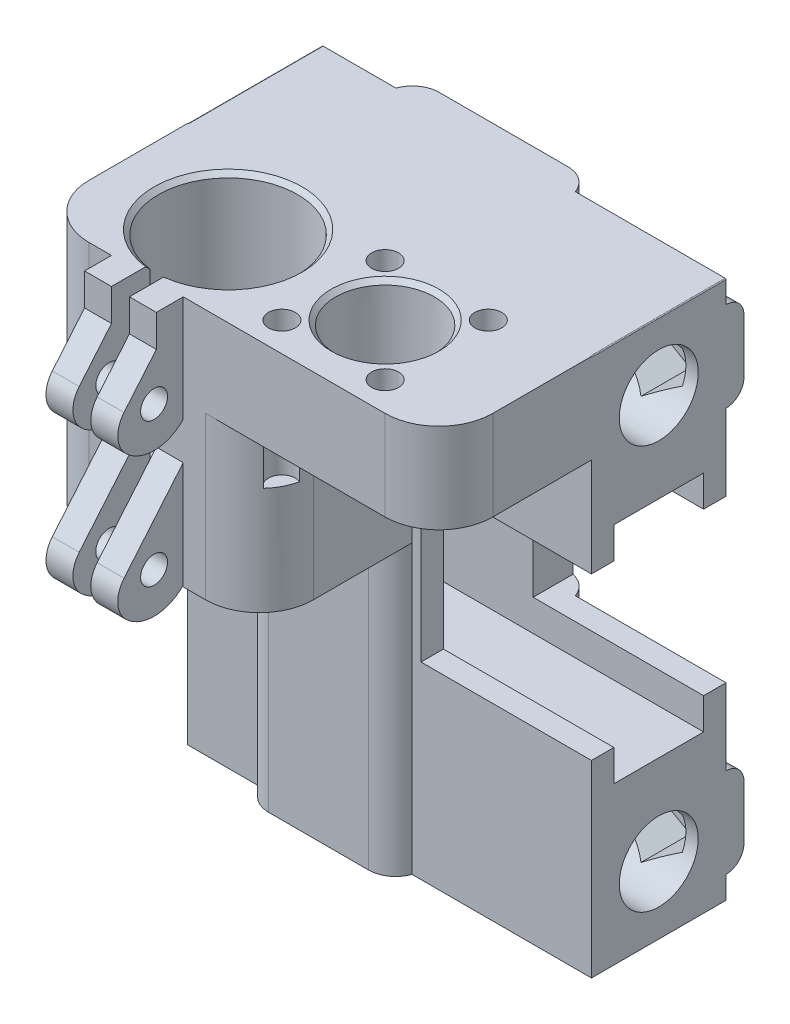
from build123d import *

# Parameters (mm, degrees)
SKETCH1_W                                = 45
SKETCH1_H                                = 60
MAINBODY_DEPTH                           = 15
SKETCH2_R                                = 4.4
SKETCH2_W                                = 10
SKETCH2_H                                = 25
RODCUTOUTS_DEPTH                         = 57.124860802
FILLET4_R                                = 0.1
SKETCH3_W                                = 17
SKETCH3_H                                = 10
BASE_DEPTH                               = 45
SKETCH4_W                                = 25
SKETCH4_H                                = 17
BOSS_EXTRUDE3_DEPTH                      = 18
SKETCH5_W                                = 2
SKETCH5_H                                = 30
CUT_EXTRUDE2_DEPTH                       = 5
SKETCH6_R                                = 5
F_8MMRODCUTOUT_DEPTH                     = 72.625763521
SKETCH7_R                                = 7.75
SKETCH7_R_2                              = 2.5
LM8UU_CARRIAGENUT_DEPTH                  = 24.5
SKETCH18_R                               = 1.5
CARRIAGENUTSCREWHOLES_DEPTH              = 16
FILLET1_R                                = 6
SKETCH11_R                               = 1.5
LM8UUSCREWLIP1_DEPTH                     = 3
LM8UUSCREWLIP2_START                     = 5
SKETCH11_2_R                             = 1.5
LM8UUSCREWLIP2_DEPTH                     = 3
LM8UUSCREWFILLET_R                       = 3
MIRROR1_START                            = -2.25
MIRROR1_OUTLINE_W                        = 10
MIRROR1_OUTLINE_H                        = 17
MIRROR1_DEPTH                            = 2.4999999
MIRROR1_START_2                          = -14
MIRROR1_2_OUTLINE_R                      = 1.5
MIRROR1_2_DEPTH                          = 3
MIRROR1_START_3                          = -9
MIRROR1_3_OUTLINE_R                      = 1.5
MIRROR1_3_DEPTH                          = 3
MIRROR1_START_4                          = 14.7500001
MIRROR1_4_OUTLINE_W                      = 10
MIRROR1_4_OUTLINE_H                      = 17
MIRROR1_4_DEPTH                          = 1.7499999
MIRROR1_START_5                          = 3.2500001
MIRROR1_5_OUTLINE_W                      = 10
MIRROR1_5_OUTLINE_H                      = 17
MIRROR1_5_DEPTH                          = 1.7499998
MIRROR1_START_6                          = 10.0000001
MIRROR1_6_OUTLINE_W                      = 10
MIRROR1_6_OUTLINE_H                      = 17
MIRROR1_6_DEPTH                          = 1.7499998
MIRROR1_START_7                          = 2
MIRROR1_7_DEPTH                          = 28
MIRROR1_START_8                          = 20
MIRROR1_8_DEPTH                          = 10
MIRROR1_9_DEPTH                          = 3.5
MIRROR1_START_9                          = 5.5
MIRROR1_10_DEPTH                         = 8.5
IDLERSCREWHOLE_DEPTH                     = 3
IDLERSCREWHOLE_DEPTH_BACK                = 45.683616854
SKETCH15_R                               = 2.125
IDLERNUTTRAP_DEPTH                       = 4
SKETCH19_W                               = 38
SKETCH19_H                               = 18
IDLERSQUARECUTOUT_DEPTH                  = 45.683616854
SKETCH22_W                               = 30
SKETCH22_H                               = 30
CUT_EXTRUDE3_DEPTH                       = 67.85286085
SKETCH20_W                               = 16.8
SKETCH20_H                               = 2
BOSS_EXTRUDE9_DEPTH                      = 32
SKETCH21_W                               = 20
SKETCH21_H                               = 2
BOSS_EXTRUDE10_DEPTH                     = 60
FILLET5_R                                = 3
SKETCH30_R                               = 5.5
CUT_EXTRUDE8_DEPTH                       = 12
SKETCH24_R                               = 8.25
ANTI_SMOOSH_DEPTH                        = 2
ANTI_SMOOSH_DRAFT                        = -45
SKETCH24_R_2                             = 6
ANTI_SMOOSH_PROFILE_2_DEPTH              = 2
ANTI_SMOOSH_PROFILE_2_DRAFT              = -45
BOSS_EXTRUDE13_START                     = -45.000025
BOSS_EXTRUDE13_DEPTH                     = 45.000025
RODTIGHTENERSCREWHOLES_REACH             = 56.319
SKETCH23_R                               = 1.75
RODTIGHTENERSCREWHOLES_DIRECTION_2_DEPTH = 55.319021891
RODTIGHTENERNUTTRAPS_REACH               = 56.319
RODTIGHTENERNUTTRAPS_DIRECTION_2_DEPTH   = 0.5
BOSS_EXTRUDE14_REACH                     = 77.17
SKETCH31_W                               = 3
SKETCH31_H                               = 3
BOSS_EXTRUDE15_START                     = -0.5
SKETCH32_R                               = 6
SKETCH32_R_2                             = 5.5
BOSS_EXTRUDE15_DEPTH                     = 9.5
BOSS_EXTRUDE15_DRAFT                     = 2
SKETCH33_W                               = 2.2
SKETCH33_H                               = 18
CUT_EXTRUDE9_DEPTH                       = 55.319021891


with BuildPart() as part:
    # Sketch1 → MainBody (new body)
    with BuildSketch(Plane.XY):
        Rectangle(SKETCH1_W, SKETCH1_H)
    extrude(amount=MAINBODY_DEPTH)

    # Sketch2 → RodCutouts (cut, through all)
    with BuildSketch(Plane(origin=(22.5, 0, 0), x_dir=(0, 0, -1), z_dir=(1, 0, 0))):
        with Locations((-7.5, 22.5)):
            Circle(SKETCH2_R)
        with Locations((-7.5, -22.5)):
            Circle(SKETCH2_R)
        with Locations((-7.5, 0)):
            Rectangle(SKETCH2_W, SKETCH2_H)
    extrude(amount=-RODCUTOUTS_DEPTH, mode=Mode.SUBTRACT)

    # Fillet4
    fillet4_edges = [part.edges().sort_by_distance(p)[0] for p in [
        (-22.5, 30, 7.5),
        (22.5, 30, 7.5),
    ]]
    fillet(fillet4_edges, radius=FILLET4_R)

    # Sketch3 → Base (add)
    with BuildSketch(Plane.ZY.offset(22.5)):
        with Locations((23.5, -25)):
            Rectangle(SKETCH3_W, SKETCH3_H)
    extrude(amount=-BASE_DEPTH)

    # Sketch4 → Boss-Extrude3 (add)
    with BuildSketch(Plane(origin=(0, -20, 0), x_dir=(1, 0, 0), z_dir=(0, 1, 0))):
        with Locations((-10, -23.5)):
            Rectangle(SKETCH4_W, SKETCH4_H)
    extrude(amount=BOSS_EXTRUDE3_DEPTH)

    # Sketch5 → Cut-Extrude2 (cut)
    with BuildSketch(Plane.XY.offset(32)):
        with Locations((-10, -16)):
            Rectangle(SKETCH5_W, SKETCH5_H)
    extrude(amount=-CUT_EXTRUDE2_DEPTH, mode=Mode.SUBTRACT)

    # Sketch6 → 8mmRodCutout (cut, through all)
    with BuildSketch(Plane.XZ.offset(30)):
        with Locations((-10, 23)):
            Circle(SKETCH6_R)
    extrude(amount=-F_8MMRODCUTOUT_DEPTH, mode=Mode.SUBTRACT)

    # Sketch7 → LM8UU&CarriageNut (cut)
    with BuildSketch(Plane.XZ.offset(30)):
        with Locations((-10, 23)):
            Circle(SKETCH7_R)
        with Locations(Location((7.5, 23, 0), (0, 0, 270))):
            Circle(SKETCH7_R_2)
    extrude(amount=-LM8UU_CARRIAGENUT_DEPTH, mode=Mode.SUBTRACT)

    # Sketch18 → CarriageNutScrewholes (cut)
    with BuildSketch(Plane.XZ.offset(30)):
        with Locations(Location((1.75, 28.75, 0), (0, 0, 270))):
            Circle(SKETCH18_R)
        with Locations(Location((13.25, 28.75, 0), (0, 0, 90))):
            Circle(SKETCH18_R)
        with Locations(Location((13.25, 17.25, 0), (0, 0, 270))):
            Circle(SKETCH18_R)
        with Locations(Location((1.75, 17.25, 0), (0, 0, 300))):
            Circle(SKETCH18_R)
    extrude(amount=-CARRIAGENUTSCREWHOLES_DEPTH, mode=Mode.SUBTRACT)

    # Fillet1
    # the kernel refuses this fillet: 6 mm, written as the material it takes off along each edge
    with BuildSketch(Plane(origin=(-22.5, -45, 32), x_dir=(0, 0, -1), z_dir=(0, 1, 0))) as fillet1_piece_1:
        with BuildLine():
            CenterArc((FILLET1_R, -FILLET1_R), FILLET1_R, 90, 90)
            Line((0, -FILLET1_R), (0, 0))
            Line((0, 0), (FILLET1_R, 0))
        make_face()
    extrude(amount=58, mode=Mode.SUBTRACT)
    with BuildSketch(Plane(origin=(22.5, -45, 32), x_dir=(0, 0, -1), z_dir=(0, 1, 0))) as fillet1_piece_2:
        with BuildLine():
            CenterArc((FILLET1_R, FILLET1_R), FILLET1_R, 180, 90)
            Line((0, FILLET1_R), (0, 0))
            Line((0, 0), (FILLET1_R, 0))
        make_face()
    extrude(amount=40, mode=Mode.SUBTRACT)
    with BuildSketch(Plane(origin=(2.5, -20, 32), x_dir=(0, 0, -1), z_dir=(0, 1, 0))) as fillet1_piece_3:
        with BuildLine():
            CenterArc((FILLET1_R, FILLET1_R), FILLET1_R, 180, 90)
            Line((0, FILLET1_R), (0, 0))
            Line((0, 0), (FILLET1_R, 0))
        make_face()
    extrude(amount=33, mode=Mode.SUBTRACT)

    # Sketch11 → LM8UUScrewLip1 (add)
    # profile 1 of 2: a face of its own
    with BuildSketch(Plane(origin=(-11, 0, 0), x_dir=(0, 0, -1), z_dir=(1, 0, 0))):
        with BuildLine():
            Line((-32, -30), (-39.723357705, -20.795660708))
            ThreePointArc((-39.723357705, -20.795660708), (-35.655854673, -16.802948792), (-30.937253933, -20))
            Line((-30.937253933, -20), (-30.937253933, -30))
            Line((-30.937253933, -30), (-32, -30))
        make_face()
        with Locations(Location((-35.25, -21.284609421, 0), (0, 0, 90))):
            Circle(SKETCH11_R, mode=Mode.SUBTRACT)
    # profile 2 of 2: a face of its own
    with BuildSketch(Plane(origin=(-11, 0, 0), x_dir=(0, 0, -1), z_dir=(1, 0, 0))):
        with BuildLine():
            Line((-30.937253933, -4), (-30.937253933, -14))
            Line((-30.937253933, -14), (-32, -14))
            Line((-32, -14), (-39.723357705, -4.795660708))
            ThreePointArc((-39.723357705, -4.795660708), (-35.655854673, -0.802948792), (-30.937253933, -4))
        make_face()
        with Locations(Location((-35.25, -5.284609421, 0), (0, 0, 90))):
            Circle(SKETCH11_R, mode=Mode.SUBTRACT)
    extrude(amount=-LM8UUSCREWLIP1_DEPTH)

    # Sketch11<2> → LM8UUScrewLip2 (add)
    # profile 1 of 2: a face of its own
    with BuildSketch(Plane(origin=(-11, 0, 0), x_dir=(0, 0, -1), z_dir=(1, 0, 0)).offset(LM8UUSCREWLIP2_START)):
        with BuildLine():
            Line((-32, -30), (-39.723357705, -20.795660708))
            ThreePointArc((-39.723357705, -20.795660708), (-35.655854673, -16.802948792), (-30.937253933, -20))
            Line((-30.937253933, -20), (-30.937253933, -30))
            Line((-30.937253933, -30), (-32, -30))
        make_face()
        with Locations(Location((-35.25, -21.284609421, 0), (0, 0, 90))):
            Circle(SKETCH11_2_R, mode=Mode.SUBTRACT)
    # profile 2 of 2: a face of its own
    with BuildSketch(Plane(origin=(-11, 0, 0), x_dir=(0, 0, -1), z_dir=(1, 0, 0)).offset(LM8UUSCREWLIP2_START)):
        with BuildLine():
            Line((-30.937253933, -4), (-30.937253933, -14))
            Line((-30.937253933, -14), (-32, -14))
            Line((-32, -14), (-39.723357705, -4.795660708))
            ThreePointArc((-39.723357705, -4.795660708), (-35.655854673, -0.802948792), (-30.937253933, -4))
        make_face()
        with Locations(Location((-35.25, -5.284609421, 0), (0, 0, 90))):
            Circle(SKETCH11_2_R, mode=Mode.SUBTRACT)
    extrude(amount=-LM8UUSCREWLIP2_DEPTH)

    # LM8UUScrewFillet
    lm8uuscrewfillet_edges = [part.edges().sort_by_distance(p)[0] for p in [
        (-12.5, -20.795660708, 39.723357705),
        (-12.5, -4.795660708, 39.723357705),
        (-7.5, -20.795660708, 39.723357705),
        (-7.5, -4.795660708, 39.723357705),
    ]]
    fillet(lm8uuscrewfillet_edges, radius=LM8UUSCREWFILLET_R)

    # Mirror1: read off the stored shape, not the designer's step
    # Mirror1 outline → Mirror1 (add)
    with BuildSketch(Plane.YZ.offset(MIRROR1_START)):
        with Locations((25, 23.5)):
            Rectangle(MIRROR1_OUTLINE_W, MIRROR1_OUTLINE_H)
    extrude(amount=MIRROR1_DEPTH)

    # Mirror1 4 outline → Mirror1 4 (add)
    with BuildSketch(Plane.YZ.offset(MIRROR1_START_4)):
        with Locations((25, 23.5)):
            Rectangle(MIRROR1_4_OUTLINE_W, MIRROR1_4_OUTLINE_H)
    extrude(amount=MIRROR1_4_DEPTH)

    # Mirror1 5 outline → Mirror1 5 (add)
    with BuildSketch(Plane.YZ.offset(MIRROR1_START_5)):
        with Locations((25, 23.5)):
            Rectangle(MIRROR1_5_OUTLINE_W, MIRROR1_5_OUTLINE_H)
    extrude(amount=MIRROR1_5_DEPTH)

    # Mirror1 6 outline → Mirror1 6 (add)
    with BuildSketch(Plane.YZ.offset(MIRROR1_START_6)):
        with Locations((25, 23.5)):
            Rectangle(MIRROR1_6_OUTLINE_W, MIRROR1_6_OUTLINE_H)
    extrude(amount=MIRROR1_6_DEPTH)



with BuildPart() as body_2:
    # Mirror1 2 outline → Mirror1 2 (new body)
    # profile 1 of 2: a face of its own
    with BuildSketch(Plane.YZ.offset(MIRROR1_START_2)):
        with BuildLine():
            ThreePointArc((2.064060508, 38.392938863), (0.785252302, 35.173937395), (2.172134521, 32))
            Line((2.172134521, 32), (14, 32))
            Line((14, 32), (6.139455945, 38.595779617))
            ThreePointArc((6.139455945, 38.595779617), (4.061961594, 39.293937293), (2.064060508, 38.392938863))
        make_face()
        with Locations((5.284609421, 35.25)):
            Circle(MIRROR1_2_OUTLINE_R, mode=Mode.SUBTRACT)
    # profile 2 of 2: a face of its own
    with BuildSketch(Plane.YZ.offset(MIRROR1_START_2)):
        with BuildLine():
            ThreePointArc((18.064060508, 38.392938863), (16.785252302, 35.173937395), (18.172134521, 32))
            Line((18.172134521, 32), (30, 32))
            Line((30, 32), (22.139455945, 38.595779617))
            ThreePointArc((22.139455945, 38.595779617), (20.061961594, 39.293937293), (18.064060508, 38.392938863))
        make_face()
        with Locations((21.284609421, 35.25)):
            Circle(MIRROR1_2_OUTLINE_R, mode=Mode.SUBTRACT)
    extrude(amount=MIRROR1_2_DEPTH)


with BuildPart() as body_3:
    # Mirror1 3 outline → Mirror1 3 (new body)
    # profile 1 of 2: a face of its own
    with BuildSketch(Plane.YZ.offset(MIRROR1_START_3)):
        with BuildLine():
            ThreePointArc((2.064060508, 38.392938863), (0.785252302, 35.173937395), (2.172134521, 32))
            Line((2.172134521, 32), (14, 32))
            Line((14, 32), (6.139455945, 38.595779617))
            ThreePointArc((6.139455945, 38.595779617), (4.061961594, 39.293937293), (2.064060508, 38.392938863))
        make_face()
        with Locations((5.284609421, 35.25)):
            Circle(MIRROR1_3_OUTLINE_R, mode=Mode.SUBTRACT)
    # profile 2 of 2: a face of its own
    with BuildSketch(Plane.YZ.offset(MIRROR1_START_3)):
        with BuildLine():
            ThreePointArc((18.064060508, 38.392938863), (16.785252302, 35.173937395), (18.172134521, 32))
            Line((18.172134521, 32), (30, 32))
            Line((30, 32), (22.139455945, 38.595779617))
            ThreePointArc((22.139455945, 38.595779617), (20.061961594, 39.293937293), (18.064060508, 38.392938863))
        make_face()
        with Locations((21.284609421, 35.25)):
            Circle(MIRROR1_3_OUTLINE_R, mode=Mode.SUBTRACT)
    extrude(amount=MIRROR1_3_DEPTH)


with BuildPart() as part_1:
    add(part.part)

    add(body_2.part)  # Mirror1 7 merges body 2

    add(body_3.part)  # Mirror1 7 merges body 3
    # Mirror1 7 outline → Mirror1 7 (add)
    with BuildSketch(Plane(origin=(0, 0, 0), x_dir=(1, 0, 0), z_dir=(0, 1, 0)).offset(MIRROR1_START_7)):
        with BuildLine():
            Line((-11, -32), (-11, -30.685213074))
            ThreePointArc((-11, -30.685213074), (-10, -15.25), (-9, -30.685213074))
            Line((-9, -30.685213074), (-9, -32))
            Line((-9, -32), (-3.5, -32))
            ThreePointArc((-3.5, -32), (-1.063368525, -31.482957875), (0.953315911, -30.020942352))
            ThreePointArc((0.953315911, -30.020942352), (0.421252697, -28.053989508), (2.341168075, -27.371406402))
            ThreePointArc((2.341168075, -27.371406402), (2.460159748, -26.690286734), (2.5, -26))
            Line((2.5, -26), (2.5, -18.549038106))
            ThreePointArc((2.5, -18.549038106), (0.25, -17.25), (2.5, -15.950961894))
            Line((2.5, -15.950961894), (2.5, -15))
            Line((2.5, -15), (-22.5, -15))
            Line((-22.5, -15), (-22.5, -26))
            ThreePointArc((-22.5, -26), (-20.742640687, -30.242640687), (-16.5, -32))
            Line((-16.5, -32), (-11, -32))
        make_face()
    extrude(amount=MIRROR1_7_DEPTH)

    # Mirror1 8 outline → Mirror1 8 (add)
    with BuildSketch(Plane(origin=(0, 0, 0), x_dir=(1, 0, 0), z_dir=(0, 1, 0)).offset(MIRROR1_START_8)):
        with BuildLine():
            Line((-2.25, -32), (-2.25, -31.868347297))
            ThreePointArc((-2.25, -31.868347297), (-2.871543073, -31.966996053), (-3.5, -32))
            Line((-3.5, -32), (-2.25, -32))
        make_face()
        with BuildLine():
            ThreePointArc((0.953315911, -30.020942352), (0.615024374, -30.366528873), (0.2499999, -30.683748579))
            Line((0.2499999, -30.683748579), (0.2499999, -32))
            Line((0.2499999, -32), (3.2500001, -32))
            Line((3.2500001, -32), (3.25, -28.75))
            ThreePointArc((3.25, -28.75), (2.476282957, -30.062445453), (0.953315911, -30.020942352))
        make_face()
        with BuildLine():
            Line((3.2500001, -15), (2.5, -15))
            Line((2.5, -15), (2.5, -15.950961894))
            ThreePointArc((2.5, -15.950961894), (3.049038106, -16.5), (3.25, -17.25))
            Line((3.25, -17.25), (3.2500001, -15))
        make_face()
        with BuildLine():
            ThreePointArc((2.341168075, -27.371406402), (3.002348217, -27.924394801), (3.25, -28.75))
            Line((3.25, -28.75), (3.25, -17.25))
            ThreePointArc((3.25, -17.25), (3.049038106, -18), (2.5, -18.549038106))
            Line((2.5, -18.549038106), (2.5, -26))
            ThreePointArc((2.5, -26), (2.460159748, -26.690286734), (2.341168075, -27.371406402))
        make_face()
        with BuildLine():
            Line((5, -23), (4.9999999, -32))
            Line((4.9999999, -32), (10.0000001, -32))
            Line((10.0000001, -32), (10, -23))
            ThreePointArc((10, -23), (7.5, -25.5), (5, -23))
        make_face()
        with BuildLine():
            Line((10.0000001, -15), (4.9999999, -15))
            Line((4.9999999, -15), (5, -23))
            ThreePointArc((5, -23), (7.5, -20.5), (10, -23))
            Line((10, -23), (10.0000001, -15))
        make_face()
        with BuildLine():
            Line((11.75, -28.75), (11.7499999, -32))
            Line((11.7499999, -32), (14.7500001, -32))
            Line((14.7500001, -32), (14.75, -28.75))
            ThreePointArc((14.75, -28.75), (13.25, -30.25), (11.75, -28.75))
        make_face()
        with BuildLine():
            Line((14.7500001, -15), (11.7499999, -15))
            Line((11.7499999, -15), (11.75, -17.25))
            ThreePointArc((11.75, -17.25), (13.25, -15.75), (14.75, -17.25))
            Line((14.75, -17.25), (14.7500001, -15))
        make_face()
        with BuildLine():
            Line((11.75, -17.25), (11.75, -28.75))
            ThreePointArc((11.75, -28.75), (13.25, -27.25), (14.75, -28.75))
            Line((14.75, -28.75), (14.75, -17.25))
            ThreePointArc((14.75, -17.25), (13.25, -18.75), (11.75, -17.25))
        make_face()
        with BuildLine():
            Line((16.5, -15), (16.5, -32))
            ThreePointArc((16.5, -32), (20.742640687, -30.242640687), (22.5, -26))
            Line((22.5, -26), (22.5, -15))
            Line((22.5, -15), (16.5, -15))
        make_face()
    extrude(amount=MIRROR1_8_DEPTH)

    # Mirror1 9 outline → Mirror1 9 (add)
    with BuildSketch(Plane(origin=(0, 0, 0), x_dir=(1, 0, 0), z_dir=(0, 1, 0)).offset(MIRROR1_START_7)):
        with BuildLine():
            ThreePointArc((-9, -30.685213074), (-10, -15.25), (-11, -30.685213074))
            Line((-11, -30.685213074), (-11, -27.898979486))
            ThreePointArc((-11, -27.898979486), (-10, -18), (-9, -27.898979486))
            Line((-9, -27.898979486), (-9, -30.685213074))
        make_face()
        with BuildLine():
            ThreePointArc((2.341168075, -27.371406402), (0.421252697, -28.053989508), (0.953315911, -30.020942352))
            ThreePointArc((0.953315911, -30.020942352), (1.814989212, -28.784041968), (2.341168075, -27.371406402))
        make_face()
        with BuildLine():
            ThreePointArc((2.5, -15.950961894), (0.25, -17.25), (2.5, -18.549038106))
            Line((2.5, -18.549038106), (2.5, -15.950961894))
        make_face()
    extrude(amount=MIRROR1_9_DEPTH)

    # Mirror1 10 outline → Mirror1 10 (add)
    with BuildSketch(Plane(origin=(0, 0, 0), x_dir=(1, 0, 0), z_dir=(0, 1, 0)).offset(MIRROR1_START_9)):
        with BuildLine():
            ThreePointArc((2.341168075, -27.371406402), (0.421252697, -28.053989508), (0.953315911, -30.020942352))
            ThreePointArc((0.953315911, -30.020942352), (1.814989212, -28.784041968), (2.341168075, -27.371406402))
        make_face()
        with BuildLine():
            ThreePointArc((2.5, -15.950961894), (0.25, -17.25), (2.5, -18.549038106))
            Line((2.5, -18.549038106), (2.5, -15.950961894))
        make_face()
    extrude(amount=MIRROR1_10_DEPTH)

    # Sketch15 → IdlerScrewHole (cut, two sides: drawn at the far end of the back side and taken through both)
    with BuildSketch(Plane.XY.offset(15).offset(-IDLERSCREWHOLE_DEPTH_BACK)):
        with Locations(Location((-18, 0, 0), (0, 0, 109.749922796))):
            Circle(SKETCH15_R)
    extrude(amount=IDLERSCREWHOLE_DEPTH + IDLERSCREWHOLE_DEPTH_BACK, mode=Mode.SUBTRACT)

    # Sketch17 → IdlerNutTrap (cut)
    with BuildSketch(Plane.XY.offset(15)):
        Polygon((-14.3, 2.136195996), (-18, 4.272391992), (-21.7, 2.136195996), (-21.7, -2.136195996), (-18, -4.272391992), (-14.3, -2.136195996), align=None)
    extrude(amount=IDLERNUTTRAP_DEPTH, mode=Mode.SUBTRACT)

    # Sketch19 → IdlerSquareCutout (cut, through all)
    with BuildSketch(Plane.XY.offset(15)):
        with Locations((22.5, 0)):
            Rectangle(SKETCH19_W, SKETCH19_H)
    extrude(amount=-IDLERSQUARECUTOUT_DEPTH, mode=Mode.SUBTRACT)

    # Sketch22 → Cut-Extrude3 (cut, through all)
    with BuildSketch(Plane(origin=(22.5, 0, 0), x_dir=(0, 0, -1), z_dir=(1, 0, 0))):
        with Locations((-30, -15)):
            Rectangle(SKETCH22_W, SKETCH22_H)
    extrude(amount=-CUT_EXTRUDE3_DEPTH, mode=Mode.SUBTRACT)

    # Sketch20 → Boss-Extrude9 (add, through all)
    with BuildSketch(Plane(origin=(0, 2, 0), x_dir=(1, 0, 0), z_dir=(0, 1, 0))):
        with Locations((-5.9, -16)):
            Rectangle(SKETCH20_W, SKETCH20_H)
    extrude(amount=-BOSS_EXTRUDE9_DEPTH)

    # Sketch21 → Boss-Extrude10 (add, through all)
    with BuildSketch(Plane.XZ.offset(30)):
        with Locations((-4.3, -1)):
            Rectangle(SKETCH21_W, SKETCH21_H)
    extrude(amount=-BOSS_EXTRUDE10_DEPTH)

    # Fillet5
    # the kernel refuses this fillet: 3 mm, written as the material it takes off along each edge
    with BuildSketch(Plane(origin=(-14.3, 2, 17), x_dir=(0, 0, -1), z_dir=(0, -1, 0))) as fillet5_piece_1:
        with BuildLine():
            CenterArc((3, 2.828427125), FILLET5_R, 180, 70.528779366)
            Line((0, 2.828427125), (-0.06, 2.828427125))
            Line((-0.06, 2.828427125), (-0.06, 0))
            Line((-0.06, 0), (0, -0.06))
            ThreePointArc((0, -0.06), (1, -0.06), (1.98, -0.056568542))
            Line((1.98, -0.056568542), (2, 0))
        make_face()
    extrude(amount=39.071067812, mode=Mode.SUBTRACT)
    with BuildSketch(Plane(origin=(2.5, 2, 17), x_dir=(0, 0, -1), z_dir=(0, -1, 0))) as fillet5_piece_2:
        with BuildLine():
            CenterArc((3, -2.828427125), FILLET5_R, 109.471220634, 70.528779366)
            Line((0, -2.828427125), (-0.06, -2.828427125))
            Line((-0.06, -2.828427125), (-0.06, 0))
            Line((-0.06, 0), (0, 0.06))
            ThreePointArc((0, 0.06), (1, 0.06), (1.98, 0.056568542))
            Line((1.98, 0.056568542), (2, 0))
        make_face()
    extrude(amount=39.071067812, mode=Mode.SUBTRACT)
    with BuildSketch(Plane(origin=(-14.3, -37.071067812, -2), x_dir=(0, 0, 1), z_dir=(0, 1, 0))) as fillet5_piece_3:
        with BuildLine():
            CenterArc((3, 2.828427125), FILLET5_R, 180, 70.528779366)
            Line((0, 2.828427125), (-0.06, 2.828427125))
            Line((-0.06, 2.828427125), (-0.06, 0))
            Line((-0.06, 0), (0, -0.06))
            ThreePointArc((0, -0.06), (1, -0.06), (1.98, -0.056568542))
            Line((1.98, -0.056568542), (2, 0))
        make_face()
    extrude(amount=74.142135624, mode=Mode.SUBTRACT)
    with BuildSketch(Plane(origin=(5.7, -37.071067812, -2), x_dir=(0, 0, 1), z_dir=(0, 1, 0))) as fillet5_piece_4:
        with BuildLine():
            CenterArc((3, -2.828427125), FILLET5_R, 109.471220634, 70.528779366)
            Line((0, -2.828427125), (-0.06, -2.828427125))
            Line((-0.06, -2.828427125), (-0.06, 0))
            Line((-0.06, 0), (0, 0.06))
            ThreePointArc((0, 0.06), (1, 0.06), (1.98, 0.056568542))
            Line((1.98, 0.056568542), (2, 0))
        make_face()
    extrude(amount=74.142135624, mode=Mode.SUBTRACT)

    # Sketch30 → Cut-Extrude8 (cut)
    with BuildSketch(Plane(origin=(0, 30, 0), x_dir=(1, 0, 0), z_dir=(0, 1, 0))):
        with Locations(Location((7.5, -23, 0), (0, 0, 270))):
            Circle(SKETCH30_R)
    extrude(amount=-CUT_EXTRUDE8_DEPTH, mode=Mode.SUBTRACT)


with BuildPart() as anti_smoosh_tool:
    # Sketch24 → anti-smoosh (with draft: the straight prism first)
    with BuildSketch(Plane(origin=(0, 30, 0), x_dir=(1, 0, 0), z_dir=(0, 1, 0))):
        with Locations((-10, -23)):
            Circle(SKETCH24_R)
    extrude(amount=-ANTI_SMOOSH_DEPTH)
    # anti-smoosh: the draft: its side faces are tilted about the plane it starts from
    anti_smoosh_sides = [anti_smoosh_tool.faces().sort_by_distance(p)[0] for p in [
        (-18.25, 29, 23),
    ]]
    draft(anti_smoosh_sides, Plane(origin=(0, 30, 0), x_dir=(1, 0, 0), z_dir=(0, 1, 0)), ANTI_SMOOSH_DRAFT)


with BuildPart() as part_2:
    add(part_1.part)

    # anti-smoosh: cut by anti_smoosh_tool
    add(anti_smoosh_tool.part, mode=Mode.SUBTRACT)


with BuildPart() as anti_smoosh_profile_2_tool:
    # Sketch24 → anti-smoosh profile 2 (with draft: the straight prism first)
    with BuildSketch(Plane(origin=(0, 30, 0), x_dir=(1, 0, 0), z_dir=(0, 1, 0))):
        with Locations((7.5, -23)):
            Circle(SKETCH24_R_2)
    extrude(amount=-ANTI_SMOOSH_PROFILE_2_DEPTH)
    # anti-smoosh profile 2: the draft: its side faces are tilted about the plane it starts from
    anti_smoosh_profile_2_sides = [anti_smoosh_profile_2_tool.faces().sort_by_distance(p)[0] for p in [
        (1.5, 29, 23),
    ]]
    draft(anti_smoosh_profile_2_sides, Plane(origin=(0, 30, 0), x_dir=(1, 0, 0), z_dir=(0, 1, 0)), ANTI_SMOOSH_PROFILE_2_DRAFT)


with BuildPart() as part_3:
    add(part_2.part)

    # anti-smoosh profile 2: cut by anti_smoosh_profile_2_tool
    add(anti_smoosh_profile_2_tool.part, mode=Mode.SUBTRACT)

    # Sketch29 → Boss-Extrude13 (add)
    with BuildSketch(Plane(origin=(22.5, 0, 0), x_dir=(0, 0, -1), z_dir=(1, 0, 0)).offset(BOSS_EXTRUDE13_START)):
        with BuildLine():
            Line((2, 19.5), (2, 25.5))
            ThreePointArc((2, 25.5), (1.414213562, 26.914213562), (0, 27.5))
            Line((0, 27.5), (0, 17.5))
            ThreePointArc((0, 17.5), (1.414213562, 18.085786438), (2, 19.5))
        make_face()
        with BuildLine():
            Line((0, -27.5), (0, -17.5))
            ThreePointArc((0, -17.5), (1.414213562, -18.085786438), (2, -19.5))
            Line((2, -19.5), (2, -25.5))
            ThreePointArc((2, -25.5), (1.414213562, -26.914213562), (0, -27.5))
        make_face()
    extrude(amount=BOSS_EXTRUDE13_DEPTH)

    # Sketch23 → RodTightenerScrewHoles (cut, up to next)
    with BuildSketch(Plane(origin=(0, 0, 0), x_dir=(-1, 0, 0), z_dir=(0, 0, -1)), mode=Mode.PRIVATE) as rodtightenerscrewholes_sk1:
        with Locations((-18, 22.5)):
            Circle(SKETCH23_R)
    rodtightenerscrewholes_tool1 = extrude(rodtightenerscrewholes_sk1.sketch, amount=-RODTIGHTENERSCREWHOLES_REACH, mode=Mode.PRIVATE) & part_3.part
    # Sketch23 → RodTightenerScrewHoles (cut, up to next)
    with BuildSketch(Plane(origin=(0, 0, 0), x_dir=(-1, 0, 0), z_dir=(0, 0, -1)), mode=Mode.PRIVATE) as rodtightenerscrewholes_sk2:
        with Locations((18, 22.5)):
            Circle(SKETCH23_R)
    rodtightenerscrewholes_tool2 = extrude(rodtightenerscrewholes_sk2.sketch, amount=-RODTIGHTENERSCREWHOLES_REACH, mode=Mode.PRIVATE) & part_3.part
    # Sketch23 → RodTightenerScrewHoles (cut, up to next)
    with BuildSketch(Plane(origin=(0, 0, 0), x_dir=(-1, 0, 0), z_dir=(0, 0, -1)), mode=Mode.PRIVATE) as rodtightenerscrewholes_sk3:
        with Locations((18, -22.5)):
            Circle(SKETCH23_R)
    rodtightenerscrewholes_tool3 = extrude(rodtightenerscrewholes_sk3.sketch, amount=-RODTIGHTENERSCREWHOLES_REACH, mode=Mode.PRIVATE) & part_3.part
    # Sketch23 → RodTightenerScrewHoles (cut, up to next)
    with BuildSketch(Plane(origin=(0, 0, 0), x_dir=(-1, 0, 0), z_dir=(0, 0, -1)), mode=Mode.PRIVATE) as rodtightenerscrewholes_sk4:
        with Locations((-18, -22.5)):
            Circle(SKETCH23_R)
    rodtightenerscrewholes_tool4 = extrude(rodtightenerscrewholes_sk4.sketch, amount=-RODTIGHTENERSCREWHOLES_REACH, mode=Mode.PRIVATE) & part_3.part
    add(rodtightenerscrewholes_tool1.solids().sort_by_distance((18, 22.5, 0))[0], mode=Mode.SUBTRACT)
    add(rodtightenerscrewholes_tool2.solids().sort_by_distance((-18, 22.5, 0))[0], mode=Mode.SUBTRACT)
    add(rodtightenerscrewholes_tool3.solids().sort_by_distance((-18, -22.5, 0))[0], mode=Mode.SUBTRACT)
    add(rodtightenerscrewholes_tool4.solids().sort_by_distance((18, -22.5, 0))[0], mode=Mode.SUBTRACT)

    # Sketch23 → RodTightenerScrewHoles direction 2 (cut)
    with BuildSketch(Plane(origin=(0, 0, 0), x_dir=(-1, 0, 0), z_dir=(0, 0, -1))):
        with Locations((-18, 22.5)):
            Circle(SKETCH23_R)
        with Locations((18, 22.5)):
            Circle(SKETCH23_R)
        with Locations((18, -22.5)):
            Circle(SKETCH23_R)
        with Locations((-18, -22.5)):
            Circle(SKETCH23_R)
    extrude(amount=RODTIGHTENERSCREWHOLES_DIRECTION_2_DEPTH, mode=Mode.SUBTRACT)

    # Sketch27 → RodTightenerNutTraps (cut, up to next)
    with BuildSketch(Plane(origin=(0, 0, 0), x_dir=(-1, 0, 0), z_dir=(0, 0, -1)), mode=Mode.PRIVATE) as rodtightenernuttraps_sk1:
        Polygon((18, 26.108439182), (14.875, 24.304219591), (14.875, 20.695780409), (18, 18.891560818), (21.125, 20.695780409), (21.125, 24.304219591), align=None)
    rodtightenernuttraps_tool1 = extrude(rodtightenernuttraps_sk1.sketch, amount=-RODTIGHTENERNUTTRAPS_REACH, mode=Mode.PRIVATE) & part_3.part
    # Sketch27 → RodTightenerNutTraps (cut, up to next)
    with BuildSketch(Plane(origin=(0, 0, 0), x_dir=(-1, 0, 0), z_dir=(0, 0, -1)), mode=Mode.PRIVATE) as rodtightenernuttraps_sk2:
        Polygon((-21.125, 24.304219591), (-18, 26.108439182), (-14.875, 24.304219591), (-14.875, 20.695780409), (-18, 18.891560818), (-21.125, 20.695780409), align=None)
    rodtightenernuttraps_tool2 = extrude(rodtightenernuttraps_sk2.sketch, amount=-RODTIGHTENERNUTTRAPS_REACH, mode=Mode.PRIVATE) & part_3.part
    # Sketch27 → RodTightenerNutTraps (cut, up to next)
    with BuildSketch(Plane(origin=(0, 0, 0), x_dir=(-1, 0, 0), z_dir=(0, 0, -1)), mode=Mode.PRIVATE) as rodtightenernuttraps_sk3:
        Polygon((-18, -26.108439182), (-14.875, -24.304219591), (-14.875, -20.695780409), (-18, -18.891560818), (-21.125, -20.695780409), (-21.125, -24.304219591), align=None)
    rodtightenernuttraps_tool3 = extrude(rodtightenernuttraps_sk3.sketch, amount=-RODTIGHTENERNUTTRAPS_REACH, mode=Mode.PRIVATE) & part_3.part
    # Sketch27 → RodTightenerNutTraps (cut, up to next)
    with BuildSketch(Plane(origin=(0, 0, 0), x_dir=(-1, 0, 0), z_dir=(0, 0, -1)), mode=Mode.PRIVATE) as rodtightenernuttraps_sk4:
        Polygon((21.125, -24.304219591), (18, -26.108439182), (14.875, -24.304219591), (14.875, -20.695780409), (18, -18.891560818), (21.125, -20.695780409), align=None)
    rodtightenernuttraps_tool4 = extrude(rodtightenernuttraps_sk4.sketch, amount=-RODTIGHTENERNUTTRAPS_REACH, mode=Mode.PRIVATE) & part_3.part
    add(rodtightenernuttraps_tool1.solids().sort_by_distance((-18, 22.5, 0))[0], mode=Mode.SUBTRACT)
    add(rodtightenernuttraps_tool2.solids().sort_by_distance((18, 22.5, 0))[0], mode=Mode.SUBTRACT)
    add(rodtightenernuttraps_tool3.solids().sort_by_distance((18, -22.5, 0))[0], mode=Mode.SUBTRACT)
    add(rodtightenernuttraps_tool4.solids().sort_by_distance((-18, -22.5, 0))[0], mode=Mode.SUBTRACT)

    # Sketch27 → RodTightenerNutTraps direction 2 (cut)
    with BuildSketch(Plane(origin=(0, 0, 0), x_dir=(-1, 0, 0), z_dir=(0, 0, -1))):
        Polygon((18, 26.108439182), (14.875, 24.304219591), (14.875, 20.695780409), (18, 18.891560818), (21.125, 20.695780409), (21.125, 24.304219591), align=None)
        Polygon((-21.125, 24.304219591), (-18, 26.108439182), (-14.875, 24.304219591), (-14.875, 20.695780409), (-18, 18.891560818), (-21.125, 20.695780409), align=None)
        Polygon((-18, -26.108439182), (-14.875, -24.304219591), (-14.875, -20.695780409), (-18, -18.891560818), (-21.125, -20.695780409), (-21.125, -24.304219591), align=None)
        Polygon((21.125, -24.304219591), (18, -26.108439182), (14.875, -24.304219591), (14.875, -20.695780409), (18, -18.891560818), (21.125, -20.695780409), align=None)
    extrude(amount=RODTIGHTENERNUTTRAPS_DIRECTION_2_DEPTH, mode=Mode.SUBTRACT)

    # Boss-Extrude14: up to this face of the body (flat: up to its plane)
    boss_extrude14_end = Plane(part_3.part.faces().sort_by_distance((-12.5, 26.069727973, 35.297889808))[0])
    # Sketch31 → Boss-Extrude14 (add, up to the picked face)
    with BuildSketch(Plane(origin=(0, 30, 0), x_dir=(1, 0, 0), z_dir=(0, 1, 0)), mode=Mode.PRIVATE) as boss_extrude14_sk1:
        with Locations((-12.5, -33.5)):
            Rectangle(SKETCH31_W, SKETCH31_H)
    boss_extrude14_tool1 = split(extrude(boss_extrude14_sk1.sketch, amount=-BOSS_EXTRUDE14_REACH, mode=Mode.PRIVATE), bisect_by=boss_extrude14_end, keep=Keep.BOTH, mode=Mode.PRIVATE)
    # Sketch31 → Boss-Extrude14 (add, up to the picked face)
    with BuildSketch(Plane(origin=(0, 30, 0), x_dir=(1, 0, 0), z_dir=(0, 1, 0)), mode=Mode.PRIVATE) as boss_extrude14_sk2:
        with Locations((-7.5, -33.5)):
            Rectangle(SKETCH31_W, SKETCH31_H)
    boss_extrude14_tool2 = split(extrude(boss_extrude14_sk2.sketch, amount=-BOSS_EXTRUDE14_REACH, mode=Mode.PRIVATE), bisect_by=boss_extrude14_end, keep=Keep.BOTH, mode=Mode.PRIVATE)
    add(boss_extrude14_tool1.solids().sort_by(Axis((-12.5, 30, 33.5), (0, -1, 0)))[0])
    add(boss_extrude14_tool2.solids().sort_by(Axis((-7.5, 30, 33.5), (0, -1, 0)))[0])


with BuildPart() as boss_extrude15_tool:
    # Sketch32 → Boss-Extrude15 (with draft: the straight prism first)
    with BuildSketch(Plane(origin=(0, 30, 0), x_dir=(1, 0, 0), z_dir=(0, 1, 0)).offset(BOSS_EXTRUDE15_START)):
        with Locations((7.5, -23)):
            Circle(SKETCH32_R)
        with Locations((7.5, -23)):
            Circle(SKETCH32_R_2, mode=Mode.SUBTRACT)
    extrude(amount=-BOSS_EXTRUDE15_DEPTH)
    # Boss-Extrude15: the draft: its side faces are tilted about the plane it starts from
    boss_extrude15_sides = [boss_extrude15_tool.faces().sort_by_distance(p)[0] for p in [
        (1.5, 24.75, 23),
        (2, 24.75, 23),
    ]]
    draft(boss_extrude15_sides, Plane(origin=(0, 30, 0), x_dir=(1, 0, 0), z_dir=(0, 1, 0)).offset(BOSS_EXTRUDE15_START), BOSS_EXTRUDE15_DRAFT)


with BuildPart() as part_4:
    add(part_3.part)

    # Boss-Extrude15: add boss_extrude15_tool
    add(boss_extrude15_tool.part)

    # Sketch33 → Cut-Extrude9 (cut, through all)
    with BuildSketch(Plane.XY):
        with Locations((4.6, 0)):
            Rectangle(SKETCH33_W, SKETCH33_H)
    extrude(amount=-CUT_EXTRUDE9_DEPTH, mode=Mode.SUBTRACT)


solid = part_4.part
